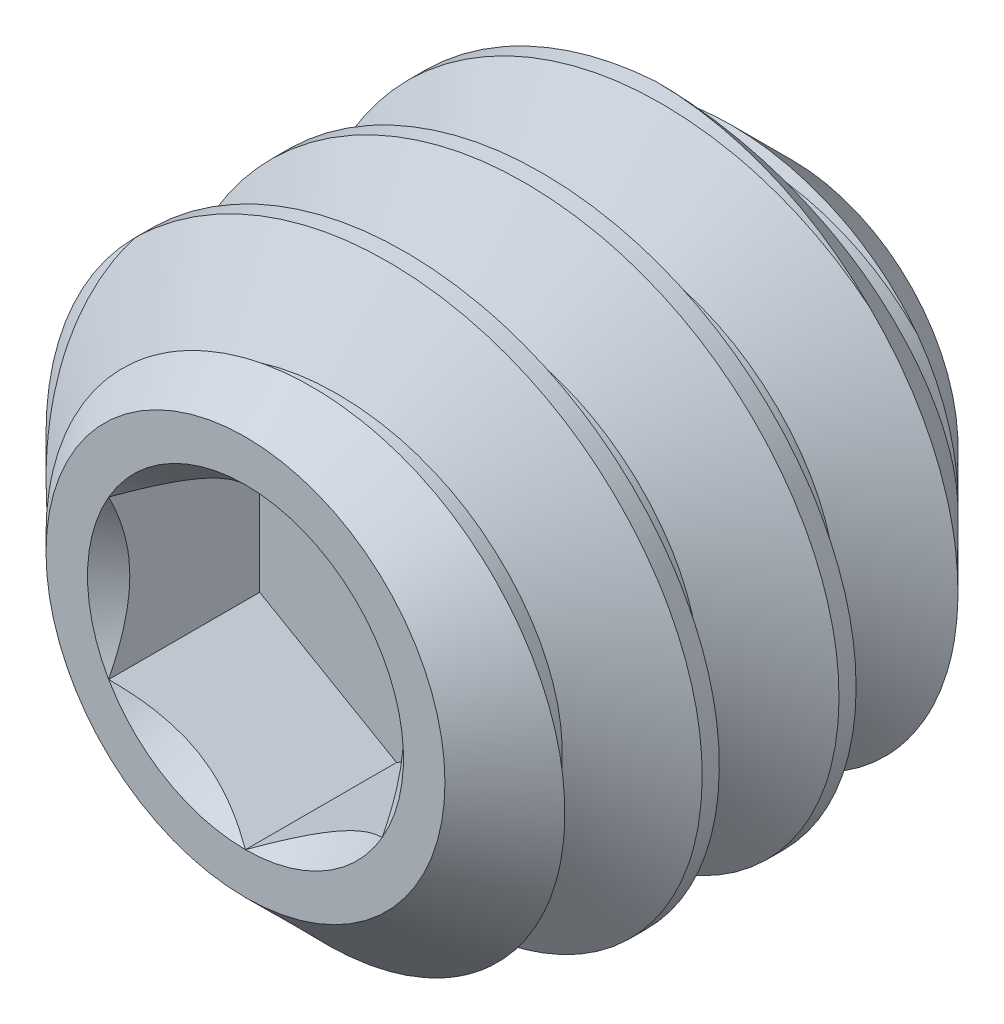
from build123d import *

# Parameters (mm, degrees)
CHAMFER1_SIZE      = 0.79375
CUT_EXTRUDE1_START = -0.8763
CUT_EXTRUDE1_DEPTH = 0.8763
SKETCH4_R          = 0.916543552
CUT_EXTRUDE2_DEPTH = 0.8763
CUT_EXTRUDE2_TAPER = 45
CUT_SWEEP1_PITCH   = 0.79375


with BuildPart() as part:
    # Sketch2 → Revolve1 (revolve)
    with BuildSketch(Plane(origin=(0, 0, 0), x_dir=(0, 0, -1), z_dir=(1, 0, 0))):
        Polygon((1.5875, 0.909240625), (1.041173115, 0), (-1.5875, 0), (-1.5875, 1.1572875), (-0.9921875, 1.7526), (1.5875, 1.7526), align=None)
    revolve(axis=Axis((0, 0, -1.041173115), (0, 0, 1)))

    # Chamfer1
    chamfer1_edges = [part.edges().sort_by_distance(p)[0] for p in [
        (0, -1.7526, -1.5875),
    ]]
    chamfer(chamfer1_edges, length=CHAMFER1_SIZE)

    # Sketch3 → Cut-Extrude1 (cut)
    with BuildSketch(Plane.XY.offset(1.5875).offset(CUT_EXTRUDE1_START)):
        Polygon((-0.79375, -0.458271776), (0, -0.916543552), (0.79375, -0.458271776), (0.79375, 0.458271776), (0, 0.916543552), (-0.79375, 0.458271776), align=None)
    extrude(amount=CUT_EXTRUDE1_DEPTH, mode=Mode.SUBTRACT)

    # Sketch4 → Cut-Extrude2 (cut)
    with BuildSketch(Plane.XY.offset(1.5875)):
        Circle(SKETCH4_R)
    extrude(amount=-CUT_EXTRUDE2_DEPTH, taper=CUT_EXTRUDE2_TAPER, mode=Mode.SUBTRACT)

    # Cut-Sweep1: the profile of Sketch8 screwed along a right-hand helix of 5.01 turns, 8 arcs to a turn; built about Z, then put on its axis
    cut_sweep1_z = Axis((0, 0, 0), (0, 0, 1))
    cut_sweep1_corners = [(1.237044252, 0, -0.396875), (1.237044252, 0, -0.29765625), (1.795562979, 0, 0.024804687), (1.795562979, 0, -0.719335938)]
    with BuildLine(mode=Mode.PRIVATE) as cut_sweep1_profile:
        Line(cut_sweep1_corners[0], cut_sweep1_corners[1])
        Line(cut_sweep1_corners[1], cut_sweep1_corners[2])
        Line(cut_sweep1_corners[2], cut_sweep1_corners[3])
        Line(cut_sweep1_corners[3], cut_sweep1_corners[0])
    cut_sweep1_cap = Face(cut_sweep1_profile.wire())
    cut_sweep1_turn_angles = [0, 22.5, 45, 67.5, 90, 112.5, 135, 157.5, 180, 202.5, 225, 247.5, 270, 292.5, 315, 337.5, 360]
    cut_sweep1_turn_weights = [1, 0.9238795325112867, 1, 0.9238795325112867, 1, 0.9238795325112867, 1, 0.9238795325112867, 1, 0.9238795325112867, 1, 0.9238795325112867, 1, 0.9238795325112867, 1, 0.9238795325112867, 1]
    cut_sweep1_turn_rails = [Edge.make_bspline([Vector(p[0], p[1], 0).rotate(cut_sweep1_z, cut_sweep1_turn_angles[k]) / cut_sweep1_turn_weights[k] + Vector(0, 0, p[2] + CUT_SWEEP1_PITCH * cut_sweep1_turn_angles[k] / 360) for k in range(17)], [0, 0, 0, 1, 1, 2, 2, 3, 3, 4, 4, 5, 5, 6, 6, 7, 7, 8, 8, 8], 2, cut_sweep1_turn_weights) for p in cut_sweep1_corners]
    cut_sweep1_turn_sides = [Face.make_surface_from_curves(cut_sweep1_turn_rails[p[0]], cut_sweep1_turn_rails[p[1]]) for p in [(0, 1), (1, 2), (2, 3), (3, 0)]]
    cut_sweep1_last_angles = [1800, 1801.8, 1803.6]
    cut_sweep1_last_weights = [1, 0.9995065603657296, 1]
    cut_sweep1_last_rails = [Edge.make_bspline([Vector(p[0], p[1], 0).rotate(cut_sweep1_z, cut_sweep1_last_angles[k]) / cut_sweep1_last_weights[k] + Vector(0, 0, p[2] + CUT_SWEEP1_PITCH * cut_sweep1_last_angles[k] / 360) for k in range(3)], [0, 0, 0, 1, 1, 1], 2, cut_sweep1_last_weights) for p in cut_sweep1_corners]
    cut_sweep1_last_sides = [Face.make_surface_from_curves(cut_sweep1_last_rails[p[0]], cut_sweep1_last_rails[p[1]]) for p in [(0, 1), (1, 2), (2, 3), (3, 0)]]
    cut_sweep1 = Plane(origin=(0, 0, -1.5875), x_dir=(0, 1, 0), z_dir=(0, 0, 1)) * Solid(Shell([*[p.moved(Location((0, 0, CUT_SWEEP1_PITCH * i))) for i in range(5) for p in cut_sweep1_turn_sides], *cut_sweep1_last_sides, cut_sweep1_cap, cut_sweep1_cap.rotate(cut_sweep1_z, 1803.6).moved(Location((0, 0, CUT_SWEEP1_PITCH * 1803.6 / 360)))]))
    add(cut_sweep1, mode=Mode.SUBTRACT)


solid = part.part
